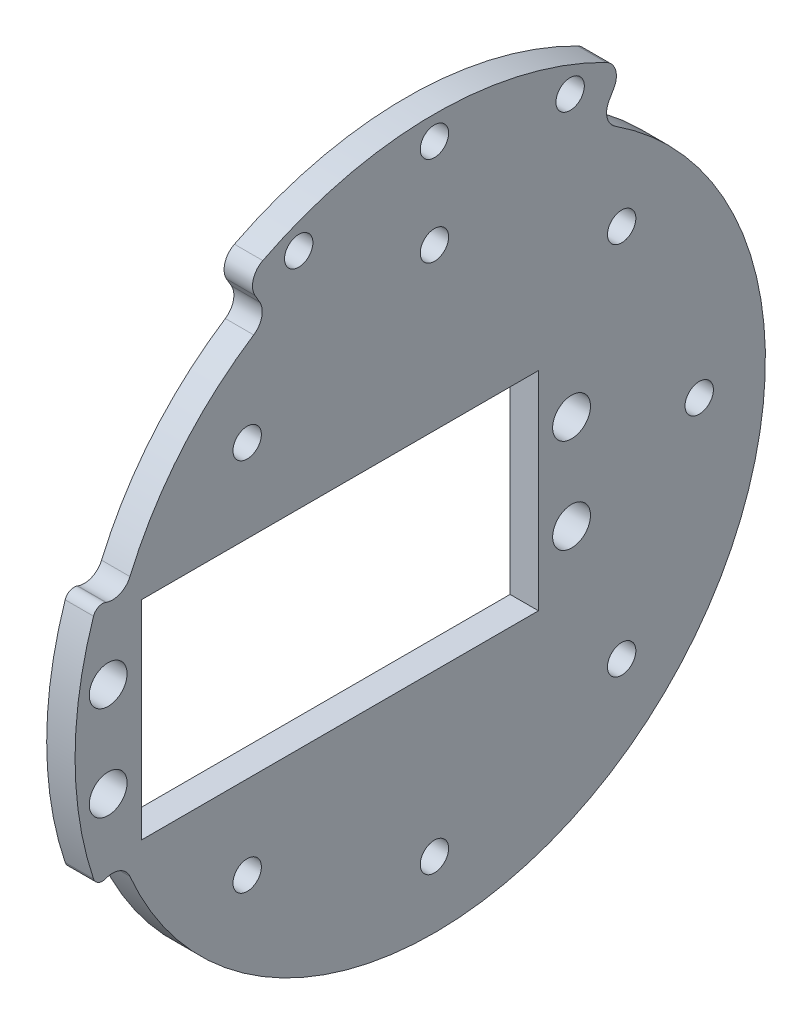
from build123d import *
from build123d.topology import SkipClean

# Parameters (mm, degrees)
SKETCH_1_R               = 35
EXTRUDE_1_DEPTH          = 3
SKETCH_2_R               = 1.5
CUT_EXTRUDE_1_DEPTH      = 3
SKETCH_3_R               = 1.5
CUT_EXTRUDE_2_DEPTH      = 3
SKETCH_4_R               = 12.5
CUT_EXTRUDE_3_DEPTH      = 3
EXTRUDE_START            = -3
EXTRUDE_4_DEPTH          = 3
FILLET_1_R               = 2
FILLET_2_R               = 2
FILLET_3_R               = 2
FILLET_4_R               = 2
SKETCH_6_R               = 1.5
CUT_EXTRUDE_4_DEPTH      = 3
SKETCH_7_R               = 2
CUT_EXTRUDE_5_DEPTH      = 8
EXTRUDE_7_DEPTH          = 3
SKETCH_10_W              = 42
SKETCH_10_H              = 22
CUT_EXTRUDE_6_DEPTH      = 3
SKETCH_11_R              = 12.5
SKETCH_11_R_2            = 1.5
EXTRUDE_9_DEPTH          = 3
SKETCH_12_W              = 42
SKETCH_12_H              = 22
CUT_EXTRUDE_7_DEPTH      = 3
EXTRUDE_11_DEPTH         = 3
SKETCH_14_R              = 1.5
EXTRUDE_12_DEPTH         = 3
FILLET_5_R               = 2
FILLET_6_R               = 2
FILLET_7_R               = 2
FILLET_8_R               = 2
CUT_EXTRUDE_8_DEPTH      = 57.648036153
CUT_EXTRUDE_8_DEPTH_BACK = 57.648036153
FILLET_9_R               = 1
FILLET_10_R              = 1


with BuildPart() as part:
    # 草图1 → 凸台-拉伸1 (new body)
    with BuildSketch(Plane(origin=(0, 0, 0), x_dir=(0, 0, -1), z_dir=(1, 0, 0))):
        Circle(SKETCH_1_R)
    extrude(amount=EXTRUDE_1_DEPTH)

    # 草图2 → 切除-拉伸1 (cut)
    with BuildSketch(Plane(origin=(3, 0, 0), x_dir=(0, 0, -1), z_dir=(1, 0, 0))):
        with Locations((0, 28)):
            Circle(SKETCH_2_R)
        with Locations((19.798989873, 19.798989873)):
            Circle(SKETCH_2_R)
        with Locations((28, 0)):
            Circle(SKETCH_2_R)
        with Locations((19.798989873, -19.798989873)):
            Circle(SKETCH_2_R)
        with Locations((0, -28)):
            Circle(SKETCH_2_R)
        with Locations((-19.798989873, -19.798989873)):
            Circle(SKETCH_2_R)
        with Locations((-28, 0)):
            Circle(SKETCH_2_R)
        with Locations((-19.798989873, 19.798989873)):
            Circle(SKETCH_2_R)
    extrude(amount=-CUT_EXTRUDE_1_DEPTH, mode=Mode.SUBTRACT)

    # 草图3 → 切除-拉伸2 (cut)
    with BuildSketch(Plane(origin=(3, 0, 0), x_dir=(0, 0, -1), z_dir=(1, 0, 0))):
        with Locations((0, 17.5)):
            Circle(SKETCH_3_R)
        with Locations((12.374368671, 12.374368671)):
            Circle(SKETCH_3_R)
        with Locations((17.5, 0)):
            Circle(SKETCH_3_R)
        with Locations((12.374368671, -12.374368671)):
            Circle(SKETCH_3_R)
        with Locations((0, -17.5)):
            Circle(SKETCH_3_R)
        with Locations((-12.374368671, -12.374368671)):
            Circle(SKETCH_3_R)
        with Locations((-17.5, 0)):
            Circle(SKETCH_3_R)
        with Locations((-12.374368671, 12.374368671)):
            Circle(SKETCH_3_R)
    extrude(amount=-CUT_EXTRUDE_2_DEPTH, mode=Mode.SUBTRACT)

    # 草图4 → 切除-拉伸3 (cut)
    with BuildSketch(Plane.ZY):
        Circle(SKETCH_4_R)
    extrude(amount=-CUT_EXTRUDE_3_DEPTH, mode=Mode.SUBTRACT)

    # 草图5 → 凸台-拉伸4 (add)
    with BuildSketch(Plane(origin=(3, 0, 0), x_dir=(0, 0, -1), z_dir=(1, 0, 0)).offset(EXTRUDE_START)):
        with BuildLine():
            Line((-20, 34.641016151), (-17.5, 30.310889132))
            ThreePointArc((-17.5, 30.310889132), (-9.058666579, 33.80740392), (0, 35))
            Line((0, 35), (0, 40))
            ThreePointArc((0, 40), (-10.352761804, 38.637033052), (-20, 34.641016151))
        make_face()
        with BuildLine():
            ThreePointArc((0, 35), (9.058666579, 33.80740392), (17.5, 30.310889132))
            Line((17.5, 30.310889132), (20, 34.641016151))
            ThreePointArc((20, 34.641016151), (10.352761804, 38.637033052), (0, 40))
            Line((0, 40), (0, 35))
        make_face()
    extrude(amount=EXTRUDE_4_DEPTH)

    # 圆角1
    fillet_1_edges = [part.edges().sort_by_distance(p)[0] for p in [
        (1.5, 34.641016151, 20),
    ]]
    fillet(fillet_1_edges, radius=FILLET_1_R)

    # 圆角2
    fillet_2_edges = [part.edges().sort_by_distance(p)[0] for p in [
        (1.5, 30.310889132, 17.5),
    ]]
    fillet(fillet_2_edges, radius=FILLET_2_R)

    # 圆角3
    fillet_3_edges = [part.edges().sort_by_distance(p)[0] for p in [
        (1.5, 30.310889132, -17.5),
    ]]
    fillet(fillet_3_edges, radius=FILLET_3_R)

    # 圆角4
    fillet_4_edges = [part.edges().sort_by_distance(p)[0] for p in [
        (1.5, 34.641016151, -20),
    ]]
    fillet(fillet_4_edges, radius=FILLET_4_R)

    # 草图6 → 切除-拉伸4 (cut)
    with BuildSketch(Plane(origin=(3, 0, 0), x_dir=(0, 0, -1), z_dir=(1, 0, 0))):
        with Locations((0, 37.5)):
            Circle(SKETCH_6_R)
        with Locations((14.350628714, 34.645482469)):
            Circle(SKETCH_6_R)
        with Locations((-14.350628714, 34.645482469)):
            Circle(SKETCH_6_R)
    extrude(amount=-CUT_EXTRUDE_4_DEPTH, mode=Mode.SUBTRACT)

    # 草图7 → 切除-拉伸5 (cut)
    with BuildSketch(Plane.ZY):
        with Locations((-14.5, 5)):
            Circle(SKETCH_7_R)
        with Locations((-14.5, -5)):
            Circle(SKETCH_7_R)
        with Locations((34.5, -5)):
            Circle(SKETCH_7_R)
        with Locations((34.5, 5)):
            Circle(SKETCH_7_R)
    extrude(amount=-CUT_EXTRUDE_5_DEPTH, mode=Mode.SUBTRACT)

    # 草图8 → 凸台-拉伸7 (add)
    with SkipClean():  # the faces are left unmerged after this step: merging them gives an invalid solid
        with BuildSketch(Plane.ZY):
            with BuildLine():
                Line((37.587704831, 13.680805733), (32.889241728, 11.970705016))
                ThreePointArc((32.889241728, 11.970705016), (33.684327683, 9.506106909), (34.295004854, 6.989466509))
                ThreePointArc((34.295004854, 6.989466509), (35.839777912, 6.484922606), (36.5, 5))
                ThreePointArc((36.5, 5), (36.038906483, 3.722593707), (34.868233163, 3.034191175))
                ThreePointArc((34.868233163, 3.034191175), (35, 0), (34.868233163, -3.034191175))
                ThreePointArc((34.868233163, -3.034191175), (36.038906483, -3.722593707), (36.5, -5))
                ThreePointArc((36.5, -5), (35.839777912, -6.484922606), (34.295004854, -6.989466509))
                ThreePointArc((34.295004854, -6.989466509), (33.684327683, -9.506106909), (32.889241728, -11.970705016))
                Line((32.889241728, -11.970705016), (37.587704831, -13.680805733))
                ThreePointArc((37.587704831, -13.680805733), (39.39231012, -6.945927107), (40, 0))
                ThreePointArc((40, 0), (39.39231012, 6.945927107), (37.587704831, 13.680805733))
            make_face()
        extrude(amount=-EXTRUDE_7_DEPTH)

    # 草图10 → 切除-拉伸6 (cut)
    with SkipClean():  # the faces are left unmerged after this step: merging them gives an invalid solid
        with BuildSketch(Plane.ZY):
            with Locations((10, 0)):
                Rectangle(SKETCH_10_W, SKETCH_10_H)
        extrude(amount=-CUT_EXTRUDE_6_DEPTH, mode=Mode.SUBTRACT)

    # 草图11 → 凸台-拉伸9 (add)
    with SkipClean():  # the faces are left unmerged after this step: merging them gives an invalid solid
        with BuildSketch(Plane.ZY):
            Circle(SKETCH_11_R)
            with Locations((-17.5, 0)):
                Circle(SKETCH_11_R_2)
        extrude(amount=-EXTRUDE_9_DEPTH)

    # 草图12 → 切除-拉伸7 (cut)
    with SkipClean():  # the faces are left unmerged after this step: merging them gives an invalid solid
        with BuildSketch(Plane.ZY):
            with Locations((10, 0)):
                Rectangle(SKETCH_12_W, SKETCH_12_H)
        extrude(amount=-CUT_EXTRUDE_7_DEPTH, mode=Mode.SUBTRACT)

    # 草图13 → 凸台-拉伸11 (add)
    with SkipClean():  # the faces are left unmerged after this step: merging them gives an invalid solid
        with BuildSketch(Plane.ZY.offset(EXTRUDE_START)):
            with BuildLine():
                ThreePointArc((13.874368671, 12.374368671), (11.553207108, 13.629635052), (11.773443753, 11))
                Line((11.773443753, 11), (12.975293589, 11))
                ThreePointArc((12.975293589, 11), (13.629635052, 11.553207108), (13.874368671, 12.374368671))
            make_face()
            with BuildLine():
                Line((12.975293589, -11), (11.773443753, -11))
                ThreePointArc((11.773443753, -11), (11.553207108, -13.629635052), (13.874368671, -12.374368671))
                ThreePointArc((13.874368671, -12.374368671), (13.629635052, -11.553207108), (12.975293589, -11))
            make_face()
        extrude(amount=EXTRUDE_11_DEPTH)

    # 草图14 → 凸台-拉伸12 (add)
    with SkipClean():  # the faces are left unmerged after this step: merging them gives an invalid solid
        with BuildSketch(Plane.ZY.offset(EXTRUDE_START)):
            with Locations((-12.374368671, 12.374368671)):
                Circle(SKETCH_14_R)
            with Locations((0, 17.5)):
                Circle(SKETCH_14_R)
            with Locations((-12.374368671, -12.374368671)):
                Circle(SKETCH_14_R)
            with Locations((0, -17.5)):
                Circle(SKETCH_14_R)
        extrude(amount=EXTRUDE_12_DEPTH)

    # 圆角5
    fillet_5_edges = [part.edges().sort_by_distance(p)[0] for p in [
        (1.5, 13.680805733, 37.587704831),
    ]]
    fillet(fillet_5_edges, radius=FILLET_5_R)

    # 圆角6
    fillet_6_edges = [part.edges().sort_by_distance(p)[0] for p in [
        (1.5, -11.970705016, 32.889241728),
    ]]
    fillet(fillet_6_edges, radius=FILLET_6_R)

    # 圆角7
    fillet_7_edges = [part.edges().sort_by_distance(p)[0] for p in [
        (1.5, 11.970705016, 32.889241728),
    ]]
    fillet(fillet_7_edges, radius=FILLET_7_R)

    # 圆角8
    fillet_8_edges = [part.edges().sort_by_distance(p)[0] for p in [
        (1.5, -13.680805733, 37.587704831),
    ]]
    fillet(fillet_8_edges, radius=FILLET_8_R)

    # 草图15 → 切除-拉伸8 (cut, two sides: drawn at the far end of the back side and taken through both)
    with SkipClean():  # the faces are left unmerged after this step: merging them gives an invalid solid
        with BuildSketch(Plane.ZY.offset(-CUT_EXTRUDE_8_DEPTH_BACK)):
            with BuildLine():
                ThreePointArc((38.255650602, 11.683543854), (37.259018757, 12.877193403), (35.70855681, 12.996113672))
                ThreePointArc((35.70855681, 12.996113672), (37.422754834, 6.598289219), (38, 0))
                ThreePointArc((38, 0), (37.422754834, -6.598289219), (35.70855681, -12.996113672))
                ThreePointArc((35.70855681, -12.996113672), (37.259018757, -12.877193403), (38.255650602, -11.683543854))
                ThreePointArc((38.255650602, -11.683543854), (39.561509224, -5.906520799), (40, 0))
                ThreePointArc((40, 0), (39.561509224, 5.906520799), (38.255650602, 11.683543854))
            make_face()
        extrude(amount=CUT_EXTRUDE_8_DEPTH + CUT_EXTRUDE_8_DEPTH_BACK, mode=Mode.SUBTRACT)

    # 圆角9
    # the kernel refuses this fillet: 1 mm, written as the material it takes off along each edge
    with BuildSketch(Plane(origin=(5.566068235, 12.996113672, 35.70855681), x_dir=(0, -0.3413769828349391, -0.9399264628631933), z_dir=(-1, 0, 0))) as fillet_9_piece_1:
        with BuildLine():
            CenterArc((1.012831861, 0.999999766), FILLET_9_R, 178.49048731, 91.548723167)
            Line((0.013178896, 1.026342685), (-0.0867864, 1.028976977))
            ThreePointArc((-0.0867864, 1.028976977), (-0.096867816, 0.5144998), (-0.099999978, -6.661e-05))
            Line((-0.099999978, -6.661e-05), (-0.002564992, -0.099967099))
            ThreePointArc((-0.002564992, -0.099967099), (0.052736969, -0.100657535), (1.013584648, -0.099999977))
            Line((1.013584648, -0.099999977), (1.013516213, 0))
        make_face()
    extrude(amount=8.132136469, mode=Mode.SUBTRACT)

    # 圆角10
    # the kernel refuses this fillet: 1 mm, written as the material it takes off along each edge
    with BuildSketch(Plane(origin=(-2.566068235, -12.996113672, 35.70855681), x_dir=(0, 0.9442321213290604, 0.3292805810405803), z_dir=(1, 0, 0))) as fillet_10_piece_1:
        with BuildLine():
            CenterArc((1.012921672, -0.999908795), FILLET_10_R, 89.226161317, 91.548723167)
            Line((0.013013123, -1.013432668), (-0.086977731, -1.014785056))
            ThreePointArc((-0.086977731, -1.014785056), (-0.099972117, -0.054025023), (-0.099991792, 0.001281244))
            Line((-0.099991792, 0.001281244), (-0.001350562, 0.099990879))
            ThreePointArc((-0.001350562, 0.099990879), (0.513213647, 0.103465793), (1.027777856, 0.099990879))
            Line((1.027777856, 0.099990879), (1.026427294, 0))
        make_face()
    extrude(amount=8.132136469, mode=Mode.SUBTRACT)


solid = part.part
